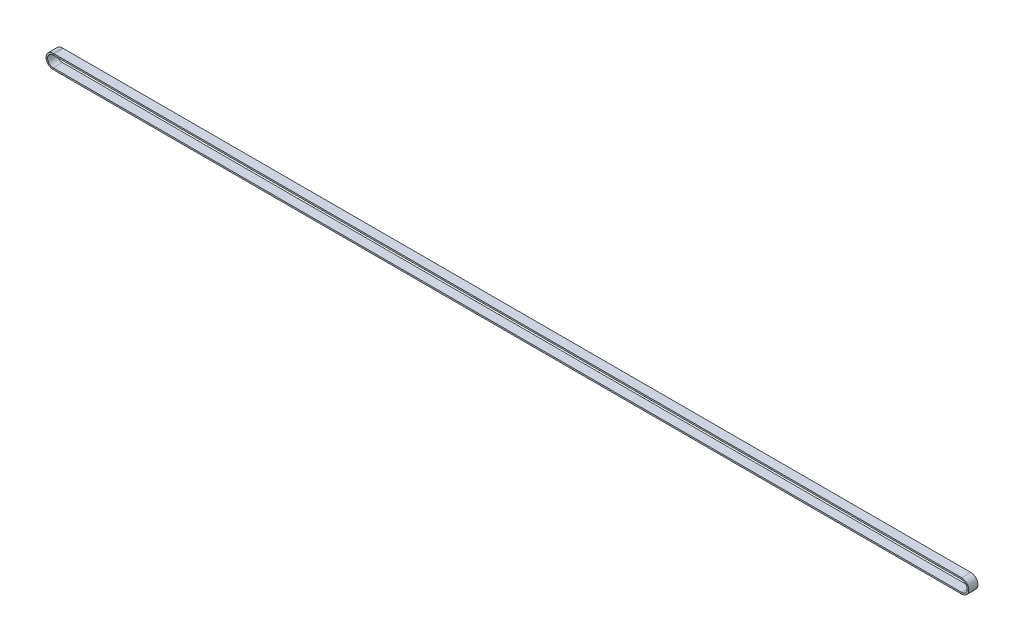
from build123d import *

# Parameters (mm, degrees)
SKETCH3_W = 9
SKETCH3_H = 1.5


with BuildPart() as part:
    # Sweep1: sweep along a path in Sketch2
    with BuildLine(Plane.XY.offset(-19.233366658)) as sweep1_path:
        Line((-1, -57.694474935), (883.520637828, -57.694474935))
        ThreePointArc((883.520637828, -57.694474935), (890.420637828, -64.594474935), (883.520637828, -71.494474935))
        Line((883.520637828, -71.494474935), (-1, -71.494474935))
        ThreePointArc((-1, -71.494474935), (-7.9, -64.594474935), (-1, -57.694474935))
    # Sketch3 → Sweep1 (sweep)
    with BuildSketch(Plane(origin=(0, 0, 0), x_dir=(0, 0, -1), z_dir=(1, 0, 0))):
        with Locations((14.733366658, -58.444474935)):
            Rectangle(SKETCH3_W, SKETCH3_H)
    sweep(path=sweep1_path.line)


solid = part.part
